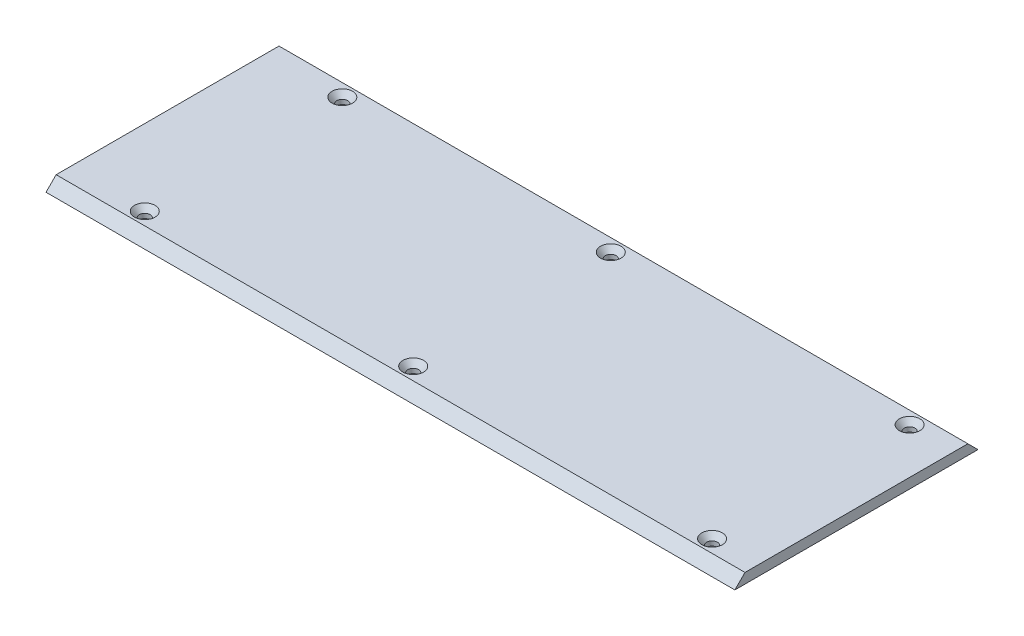
from build123d import *

# Parameters (mm, degrees)
SKETCH1_W                                     = 431.8
SKETCH1_H                                     = 152.4
BOSS_EXTRUDE1_DEPTH                           = 6.35
CHAMFER1_SIZE                                 = 6.35
CSK_FOR_1_4_FLAT_HEAD_MACHINE_SCREW1_AT_COUNT = 2
CSK_FOR_1_4_FLAT_HEAD_MACHINE_SCREW1_AT_PITCH = 187.325
CSK_FOR_1_4_FLAT_HEAD_MACHINE_SCREW1_2_COUNT  = 2
CSK_FOR_1_4_FLAT_HEAD_MACHINE_SCREW1_2_PITCH  = 355.6
CSK_FOR_1_4_FLAT_HEAD_MACHINE_SCREW1_3_COUNT  = 2
CSK_FOR_1_4_FLAT_HEAD_MACHINE_SCREW1_3_PITCH  = 376.542149865
CSK_FOR_1_4_FLAT_HEAD_MACHINE_SCREW1_4_COUNT  = 2
CSK_FOR_1_4_FLAT_HEAD_MACHINE_SCREW1_4_PITCH  = 123.825
CSK_FOR_1_4_FLAT_HEAD_MACHINE_SCREW1_5_COUNT  = 2
CSK_FOR_1_4_FLAT_HEAD_MACHINE_SCREW1_5_PITCH  = 224.551299818


with BuildPart() as part:
    # Sketch1 → Boss-Extrude1 (new body)
    with BuildSketch(Plane(origin=(0, 0, 0), x_dir=(1, 0, 0), z_dir=(0, 1, 0))):
        Rectangle(SKETCH1_W, SKETCH1_H)
    extrude(amount=BOSS_EXTRUDE1_DEPTH)

    # Chamfer1
    chamfer1_edges = [part.edges().sort_by_distance(p)[0] for p in [
        (0, 6.35, 76.2),
        (0, 6.35, -76.2),
    ]]
    chamfer(chamfer1_edges, length=CHAMFER1_SIZE - 0.0001)  # a hair under: the kernel refuses the full size

    # Sketch3 → CSK for 1/4 Flat Head Machine Screw1 (revolve, cut)
    with BuildSketch(Plane(origin=(187.325, 6.35, 61.9125), x_dir=(0, 0, 1), z_dir=(1, 0, 0))):
        Polygon((0, 0), (0, 6.35), (3.3782, 6.35), (3.3782, 3.520932584), (6.4389, 0), align=None)
    csk_for_1_4_flat_head_machine_screw1 = revolve(axis=Axis((187.325, 12.7, 61.9125), (0, -1, 0)), mode=Mode.SUBTRACT)

    # CSK for 1/4 Flat Head Machine Screw1 at: CSK for 1/4 Flat Head Machine Screw1 ×2
    with Locations(*[(-i * CSK_FOR_1_4_FLAT_HEAD_MACHINE_SCREW1_AT_PITCH, 0, 0) for i in range(1, CSK_FOR_1_4_FLAT_HEAD_MACHINE_SCREW1_AT_COUNT)]):
        add(csk_for_1_4_flat_head_machine_screw1, mode=Mode.SUBTRACT)

    # CSK for 1_4 Flat Head Machine Screw1 2: CSK for 1/4 Flat Head Machine Screw1 ×2
    with Locations(*[(-i * CSK_FOR_1_4_FLAT_HEAD_MACHINE_SCREW1_2_PITCH, 0, 0) for i in range(1, CSK_FOR_1_4_FLAT_HEAD_MACHINE_SCREW1_2_COUNT)]):
        add(csk_for_1_4_flat_head_machine_screw1, mode=Mode.SUBTRACT)

    # CSK for 1_4 Flat Head Machine Screw1 3: CSK for 1/4 Flat Head Machine Screw1 ×2
    with Locations(*[Vector(-0.9443829864131722, 0, -0.32884764705458697) * (i * CSK_FOR_1_4_FLAT_HEAD_MACHINE_SCREW1_3_PITCH) for i in range(1, CSK_FOR_1_4_FLAT_HEAD_MACHINE_SCREW1_3_COUNT)]):
        add(csk_for_1_4_flat_head_machine_screw1, mode=Mode.SUBTRACT)

    # CSK for 1_4 Flat Head Machine Screw1 4: CSK for 1/4 Flat Head Machine Screw1 ×2
    with Locations(*[(0, 0, -i * CSK_FOR_1_4_FLAT_HEAD_MACHINE_SCREW1_4_PITCH) for i in range(1, CSK_FOR_1_4_FLAT_HEAD_MACHINE_SCREW1_4_COUNT)]):
        add(csk_for_1_4_flat_head_machine_screw1, mode=Mode.SUBTRACT)

    # CSK for 1_4 Flat Head Machine Screw1 5: CSK for 1/4 Flat Head Machine Screw1 ×2
    with Locations(*[Vector(-0.8342191746462441, 0, -0.5514330137492126) * (i * CSK_FOR_1_4_FLAT_HEAD_MACHINE_SCREW1_5_PITCH) for i in range(1, CSK_FOR_1_4_FLAT_HEAD_MACHINE_SCREW1_5_COUNT)]):
        add(csk_for_1_4_flat_head_machine_screw1, mode=Mode.SUBTRACT)


solid = part.part
